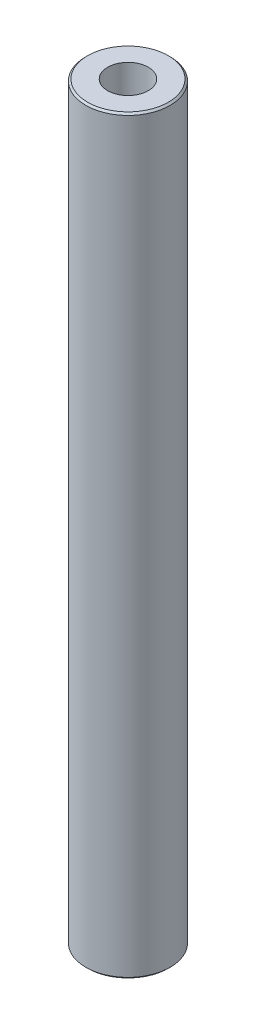
from build123d import *

# Parameters (mm, degrees)
SKETCH1_R           = 30
BOSS_EXTRUDE1_DEPTH = 533.684171175
SKETCH2_R           = 14.474919074
CUT_EXTRUDE1_DEPTH  = 536.367905802
CHAMFER1_SIZE       = 1.285484163


with BuildPart() as part:
    # Sketch1 → Boss-Extrude1 (new body)
    with BuildSketch(Plane(origin=(0, 0, 0), x_dir=(1, 0, 0), z_dir=(0, 1, 0))):
        Circle(SKETCH1_R)
    extrude(amount=BOSS_EXTRUDE1_DEPTH)

    # Sketch2 → Cut-Extrude1 (cut, through all)
    with BuildSketch(Plane(origin=(0, 0, 0), x_dir=(1, 0, 0), z_dir=(0, 1, 0))):
        Circle(SKETCH2_R)
    extrude(amount=CUT_EXTRUDE1_DEPTH, mode=Mode.SUBTRACT)

    # Chamfer1
    chamfer1_edges = [part.edges().sort_by_distance(p)[0] for p in [
        (-30, 533.684171175, 0),
        (-30, 0, 0),
    ]]
    chamfer(chamfer1_edges, length=CHAMFER1_SIZE)


solid = part.part
